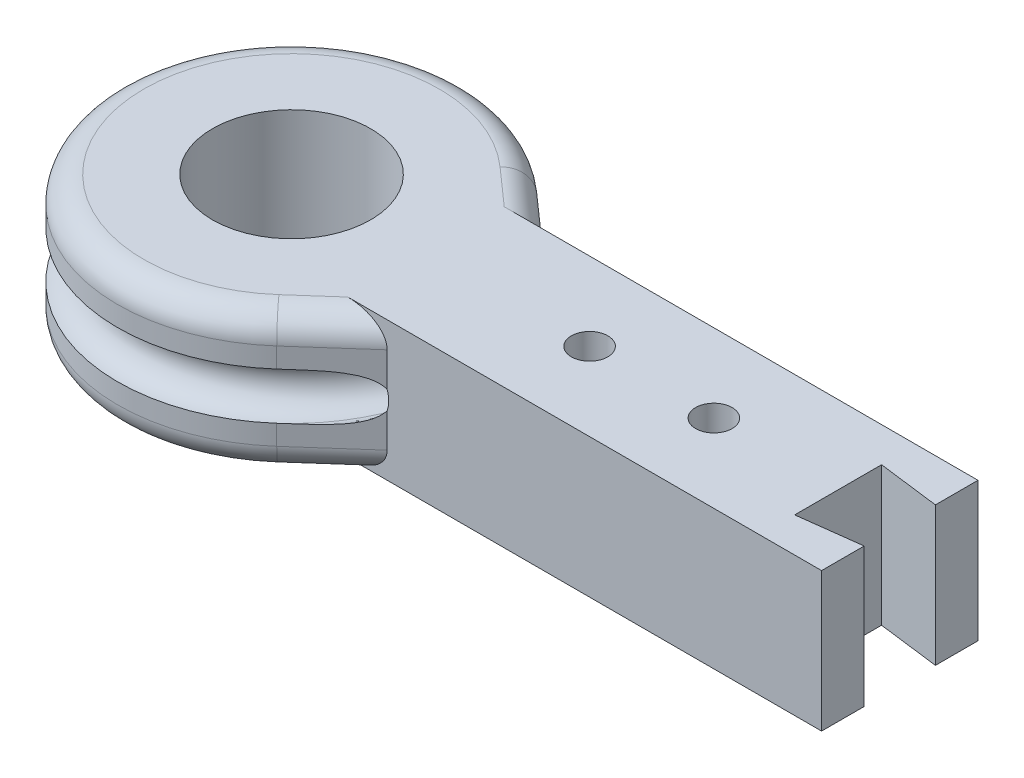
from build123d import *

# Parameters (mm, degrees)
SKETCH1_R           = 4.55
BOSS_EXTRUDE2_DEPTH = 8
FILLET2_R           = 1.5
SKETCH5_R           = 1.05
CUT_EXTRUDE1_DEPTH  = 10


with BuildPart() as part:
    # Sketch1 → Boss-Extrude2 (new body)
    with BuildSketch(Plane(origin=(0, 0, 0), x_dir=(1, 0, 0), z_dir=(0, 1, 0))):
        with BuildLine():
            Line((35, 4.5), (10, 4.5))
            Line((10, 4.5), (6.632016632, 7.484407484))
            ThreePointArc((6.632016632, 7.484407484), (-10, 0), (6.632016632, -7.484407484))
            Line((6.632016632, -7.484407484), (10, -4.5))
            Line((10, -4.5), (35, -4.5))
            Line((35, -4.5), (35, -2.05))
            Line((35, -2.05), (31.45, -2.5))
            Line((31.45, -2.5), (31.45, 2.5))
            Line((31.45, 2.5), (35, 2.05))
            Line((35, 2.05), (35, 4.5))
        make_face()
        Circle(SKETCH1_R, mode=Mode.SUBTRACT)
    extrude(amount=BOSS_EXTRUDE2_DEPTH)

    # Fillet2
    fillet2_edges = [part.edges().sort_by_distance(p)[0] for p in [
        (8.316008316, 0, -5.992203742),
        (8.316008316, 0, 5.992203742),
        (8.316008316, 8, -5.992203742),
        (8.316008316, 8, 5.992203742),
        (-10, 0, 0),
        (-10, 8, 0),
    ]]
    fillet(fillet2_edges, radius=FILLET2_R)

    # Sketch5 → Cut-Extrude1 (cut)
    with BuildSketch(Plane(origin=(0, 8, 0), x_dir=(1, 0, 0), z_dir=(0, 1, 0))):
        with Locations((17.15, 0)):
            Circle(SKETCH5_R)
        with Locations((24.3, 0)):
            Circle(SKETCH5_R)
    extrude(amount=-CUT_EXTRUDE1_DEPTH, mode=Mode.SUBTRACT)

    # Sketch4 → Cut-Revolve1 (revolve, cut)
    with BuildSketch(Plane(origin=(-6.666818896, 16.535300464, 0), x_dir=(0, 1, 0), z_dir=(0, 0, 1))):
        with BuildLine():
            ThreePointArc((-13.885300464, 3.333181104), (-12.535300464, 1.983181104), (-11.185300464, 3.333181104))
            add(Edge.make_bspline(
                [(-11.185300464, 3.333181104), (-11.185300464, 4.383181104), (-12.535300464, 4.383181104), (-13.885300464, 4.383181104), (-13.885300464, 3.333181104)],
                knots=[3.141592654, 3.141592654, 3.141592654, 4.71238898, 4.71238898, 6.283185307, 6.283185307, 6.283185307], degree=2, weights=[1, 0.707106781, 1, 0.707106781, 1]))
        make_face()
    revolve(axis=Axis((0, 0, 0), (0, 1, 0)), mode=Mode.SUBTRACT)


solid = part.part
